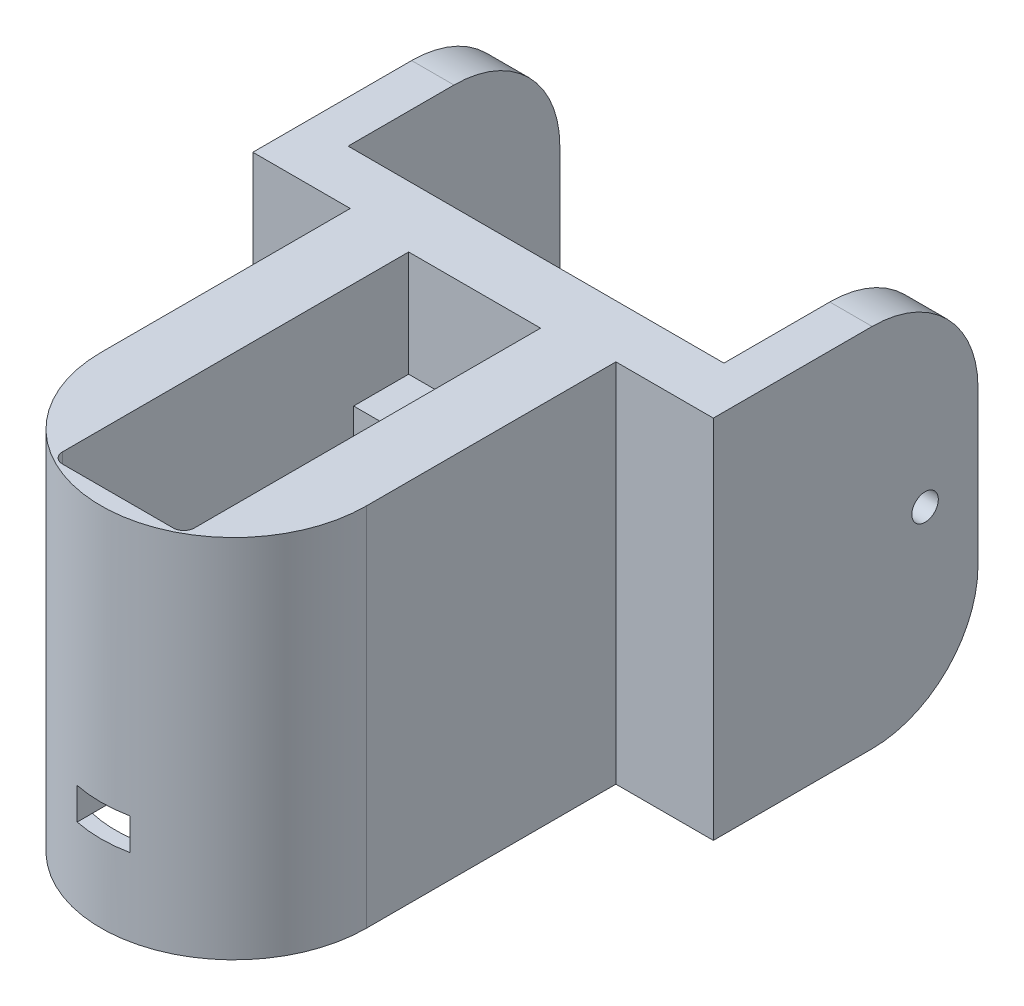
from build123d import *
from OCP.BRepFilletAPI import BRepFilletAPI_MakeChamfer

# Parameters (mm, degrees)
SKETCH4_W                = 12.46
SKETCH4_H                = 17.25
BOSS_EXTRUDE3_DEPTH      = 6
BOSS_EXTRUDE6_DEPTH      = 7.3
BOSS_EXTRUDE6_DEPTH_BACK = 17.25
SKETCH8_R                = 12.546781182
SKETCH8_R_2              = 11.15
BOSS_EXTRUDE4_DEPTH      = 17.25
SKETCH6_R                = 2
CUT_EXTRUDE1_DEPTH       = 5
CHAMFER1_SIZE            = 0.5
CHAMFER1_SIZE_2          = 0.866025404
SKETCH10_W               = 12.46
SKETCH10_H               = 23.7
CUT_EXTRUDE3_DEPTH       = 17.25
CUT_EXTRUDE4_REACH       = 43.938
SKETCH11_W               = 5
SKETCH11_H               = 3
BOSS_EXTRUDE7_START      = -7.3
BOSS_EXTRUDE7_DEPTH      = 7.3
BOSS_EXTRUDE9_START      = 10
BOSS_EXTRUDE9_DEPTH      = 10
BOSS_EXTRUDE10_DEPTH     = 34.55
SKETCH18_W               = 20
SKETCH18_H               = 12.438292938
CUT_EXTRUDE5_DEPTH       = 2
CUT_EXTRUDE6_DEPTH       = 58.651133872
CUT_EXTRUDE6_DEPTH_BACK  = 58.651133872
SKETCH19_R               = 1.25
FILLET1_R                = 10


with BuildPart() as part:
    # Sketch4 → Boss-Extrude3 (new body)
    with BuildSketch(Plane.XY):
        with Locations((0, -1.35)):
            Rectangle(SKETCH4_W, SKETCH4_H)
    extrude(amount=BOSS_EXTRUDE3_DEPTH)



with BuildPart() as body_2:
    # Sketch8 → Boss-Extrude6 (new, two sides: drawn at the far end of the back side and taken through both)
    with BuildSketch(Plane(origin=(0, -9.975, 0), x_dir=(-1, 0, 0), z_dir=(0, -1, 0)).offset(-BOSS_EXTRUDE6_DEPTH_BACK)):
        with Locations(Location((0, -23.55, 0), (0, 0, 90))):
            Circle(SKETCH8_R)
        with Locations(Location((0, -23.55, 0), (0, 0, 90))):
            Circle(SKETCH8_R_2, mode=Mode.SUBTRACT)
    extrude(amount=BOSS_EXTRUDE6_DEPTH + BOSS_EXTRUDE6_DEPTH_BACK)


with BuildPart() as part_1:
    add(part.part)

    add(body_2.part)  # Boss-Extrude4 merges body 2
    # Sketch5 → Boss-Extrude4 (add)
    with BuildSketch(Plane(origin=(0, 7.275, 0), x_dir=(1, 0, 0), z_dir=(0, 1, 0))):
        with BuildLine():
            Line((12.546781182, -23.55), (12.546781182, 0))
            Line((12.546781182, 0), (6.23, 0))
            Line((6.23, 0), (6.23, -29.7))
            Line((6.23, -29.7), (-6.23, -29.7))
            Line((-6.23, -29.7), (-6.23, 0))
            Line((-6.23, 0), (-12.546781182, 0))
            Line((-12.546781182, 0), (-12.546781182, -23.55))
            ThreePointArc((-12.546781182, -23.55), (0, -36.096781182), (12.546781182, -23.55))
        make_face()
    extrude(amount=-BOSS_EXTRUDE4_DEPTH)

    # Sketch6 → Cut-Extrude1 (cut)
    with BuildSketch(Plane(origin=(0, 7.275, 0), x_dir=(1, 0, 0), z_dir=(0, 1, 0))):
        with Locations(Location((0, -3.5, 0), (0, 0, 270))):
            Circle(SKETCH6_R)
        with Locations(Location((0, -32.2, 0), (0, 0, 270))):
            Circle(SKETCH6_R)
    extrude(amount=-CUT_EXTRUDE1_DEPTH, mode=Mode.SUBTRACT)

    # Chamfer1
    chamfer1_edges_1 = [part_1.edges().sort_by_distance(p)[0] for p in [
        (0, 7.275, 1.5),
    ]]
    chamfer1_side_1 = [part_1.faces().sort_by_distance(p)[0] for p in [
        (0, 7.275, 1.49),
    ]]
    chamfer1_edges_2 = [part_1.edges().sort_by_distance(p)[0] for p in [
        (0, 7.275, 30.2),
    ]]
    chamfer1_side_2 = [part_1.faces().sort_by_distance(p)[0] for p in [
        (0, 7.275, 30.19),
    ]]
    chamfer1 = BRepFilletAPI_MakeChamfer(part_1.part.solid().wrapped)
    for e in chamfer1_edges_1:
        chamfer1.Add(CHAMFER1_SIZE - 0.0001, CHAMFER1_SIZE_2 - 0.0001, e.wrapped, chamfer1_side_1[0].wrapped)
    for e in chamfer1_edges_2:
        chamfer1.Add(CHAMFER1_SIZE - 0.0001, CHAMFER1_SIZE_2 - 0.0001, e.wrapped, chamfer1_side_2[0].wrapped)
    add(Compound.cast(chamfer1.Shape()), mode=Mode.REPLACE)  # a hair under: the kernel refuses the full size

    # Sketch10 → Cut-Extrude3 (cut)
    with BuildSketch(Plane(origin=(0, 7.275, 0), x_dir=(1, 0, 0), z_dir=(0, 1, 0))):
        with Locations((0, -17.85)):
            Rectangle(SKETCH10_W, SKETCH10_H)
    extrude(amount=-CUT_EXTRUDE3_DEPTH, mode=Mode.SUBTRACT)

    # Sketch11 → Cut-Extrude4 (cut, up to next)
    with BuildSketch(Plane.XY.offset(36.096781182), mode=Mode.PRIVATE) as cut_extrude4_sk1:
        with Locations((0, -8.475)):
            Rectangle(SKETCH11_W, SKETCH11_H)
    cut_extrude4_tool1 = extrude(cut_extrude4_sk1.sketch, amount=-CUT_EXTRUDE4_REACH, mode=Mode.PRIVATE) & part_1.part
    add(cut_extrude4_tool1.solids().sort_by_distance((0, -8.475, 36.096781))[0], mode=Mode.SUBTRACT)

    # Sketch13 → Boss-Extrude7 (add)
    with BuildSketch(Plane.XZ.offset(17.275).offset(BOSS_EXTRUDE7_START)):
        with BuildLine():
            Line((-12.546781182, 23.55), (-12.546781182, 0))
            Line((-12.546781182, 0), (12.546781182, 0))
            Line((12.546781182, 0), (12.546781182, 23.55))
            ThreePointArc((12.546781182, 23.55), (0, 11.003218818), (-12.546781182, 23.55))
        make_face()
    extrude(amount=BOSS_EXTRUDE7_DEPTH)

    # Sketch15 → Boss-Extrude9 (add)
    with BuildSketch(Plane(origin=(0, 7.275, 0), x_dir=(1, 0, 0), z_dir=(0, 1, 0)).offset(BOSS_EXTRUDE9_START)):
        with BuildLine():
            Line((-12.546781182, 0), (12.546781182, 0))
            Line((12.546781182, 0), (12.546781182, -23.55))
            ThreePointArc((12.546781182, -23.55), (0, -36.096781182), (-12.546781182, -23.55))
            Line((-12.546781182, -23.55), (-12.546781182, 0))
        make_face()
        with BuildLine():
            Line((-6.23, -0.8), (6.23, -0.8))
            Line((6.23, -0.8), (6.23, -33.5))
            ThreePointArc((6.23, -33.5), (5.937106781, -34.207106781), (5.23, -34.5))
            Line((5.23, -34.5), (-5.23, -34.5))
            ThreePointArc((-5.23, -34.5), (-5.937106781, -34.207106781), (-6.23, -33.5))
            Line((-6.23, -33.5), (-6.23, -0.8))
        make_face(mode=Mode.SUBTRACT)
    extrude(amount=-BOSS_EXTRUDE9_DEPTH)

    # Sketch17 → Boss-Extrude10 (add)
    with BuildSketch(Plane(origin=(0, 17.275, 0), x_dir=(1, 0, 0), z_dir=(0, 1, 0))):
        Polygon((21.75, 25), (21.75, 0), (-21.75, 0), (-21.75, 25), (-17.75, 25), (-17.75, 5), (17.75, 5), (17.75, 25), align=None)
    extrude(amount=-BOSS_EXTRUDE10_DEPTH)

    # Sketch18 → Cut-Extrude5 (cut)
    with BuildSketch(Plane.ZY.offset(-17.75)):
        with Locations((-15, 0)):
            Rectangle(SKETCH18_W, SKETCH18_H)
    extrude(amount=-CUT_EXTRUDE5_DEPTH, mode=Mode.SUBTRACT)

    # Sketch19 → Cut-Extrude6 (cut, two sides: drawn at the far end of the back side and taken through both)
    with BuildSketch(Plane.ZY.offset(-19.75).offset(-CUT_EXTRUDE6_DEPTH_BACK)):
        with Locations((-20, 0)):
            Circle(SKETCH19_R)
    extrude(amount=CUT_EXTRUDE6_DEPTH + CUT_EXTRUDE6_DEPTH_BACK, mode=Mode.SUBTRACT)

    # Fillet1
    fillet1_edges = [part_1.edges().sort_by_distance(p)[0] for p in [
        (19.75, 17.275, -25),
        (-19.75, 17.275, -25),
        (-19.75, -17.275, -25),
        (19.75, -17.275, -25),
    ]]
    fillet(fillet1_edges, radius=FILLET1_R)


solid = part_1.part
